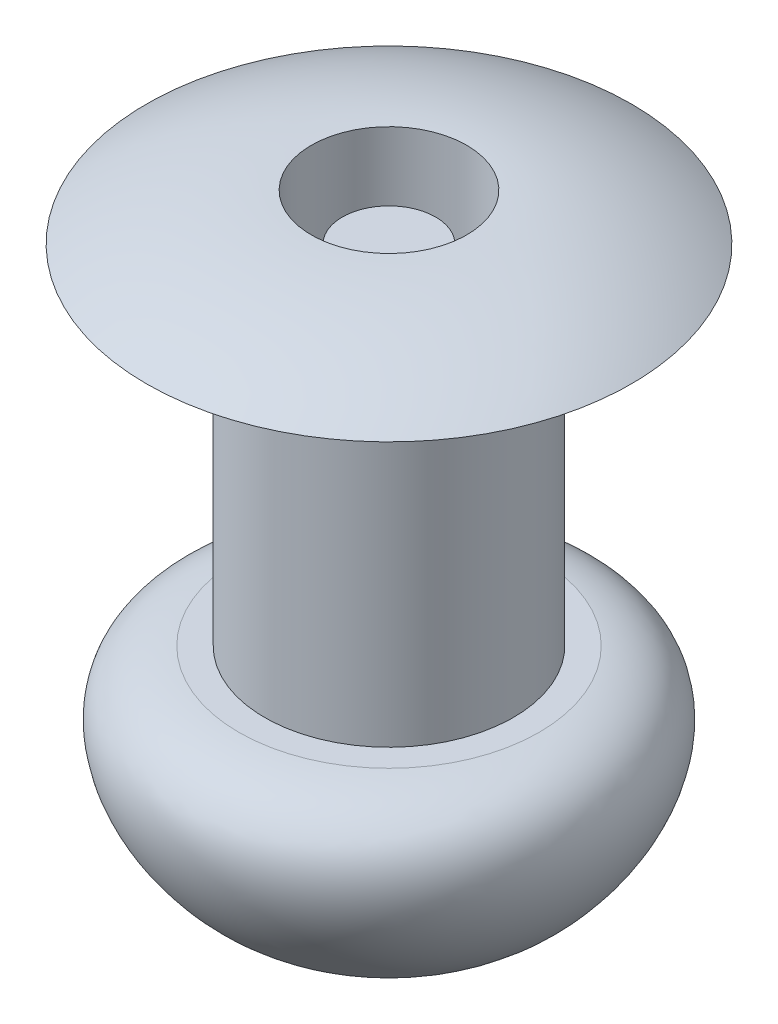
from build123d import *


with BuildPart() as part:
    # Szkic1 → Obrót1 (revolve)
    with BuildSketch(Plane(origin=(0, 0, 0), x_dir=(0, 0, -1), z_dir=(1, 0, 0))):
        with BuildLine():
            Line((0, 0), (0, -4.121746268))
            Line((0, -4.121746268), (0, -5.79843593))
            Line((0, -5.79843593), (0, -7.29843593))
            add(Edge.make_bspline(
                [(-0.956030427, -7.176626601), (-0.520263876, -7.29843593), (0, -7.29843593)],
                knots=[0.992852221, 0.992852221, 0.992852221, 1.570796327, 1.570796327, 1.570796327], degree=2, weights=[1, 0.958537313, 1]))
            add(Edge.make_bspline(
                [(-2.413891755, -5.597697407), (-3.867503112, -5.767354729), (-3.528877649, -7.899711034), (-1.083961642, -9.471229776), (-0.271752618, -7.472646705), (-0.956030427, -7.176626601)],
                knots=[0, 0, 0, 0, 0.464993082, 0.721927553, 1, 1, 1, 1], degree=3))
            Line((-2.413891755, -5.597697407), (-2, -5.597697407))
            Line((-2, -5.597697407), (-2, 0))
            Line((-2, 0), (-3.9, 0))
            ThreePointArc((-3.9, 0), (-2.627043935, 0.558888572), (-1.25, 0.75))
            Line((-1.25, 0.75), (-1.25, -5.79843593))
            Line((-1.25, -5.79843593), (-0.75, -5.79843593))
            Line((-0.75, -5.79843593), (-0.75, 0))
            Line((-0.75, 0), (0, 0))
        make_face()
    revolve(axis=Axis((0, 0, 0), (0, 1, 0)))


solid = part.part
